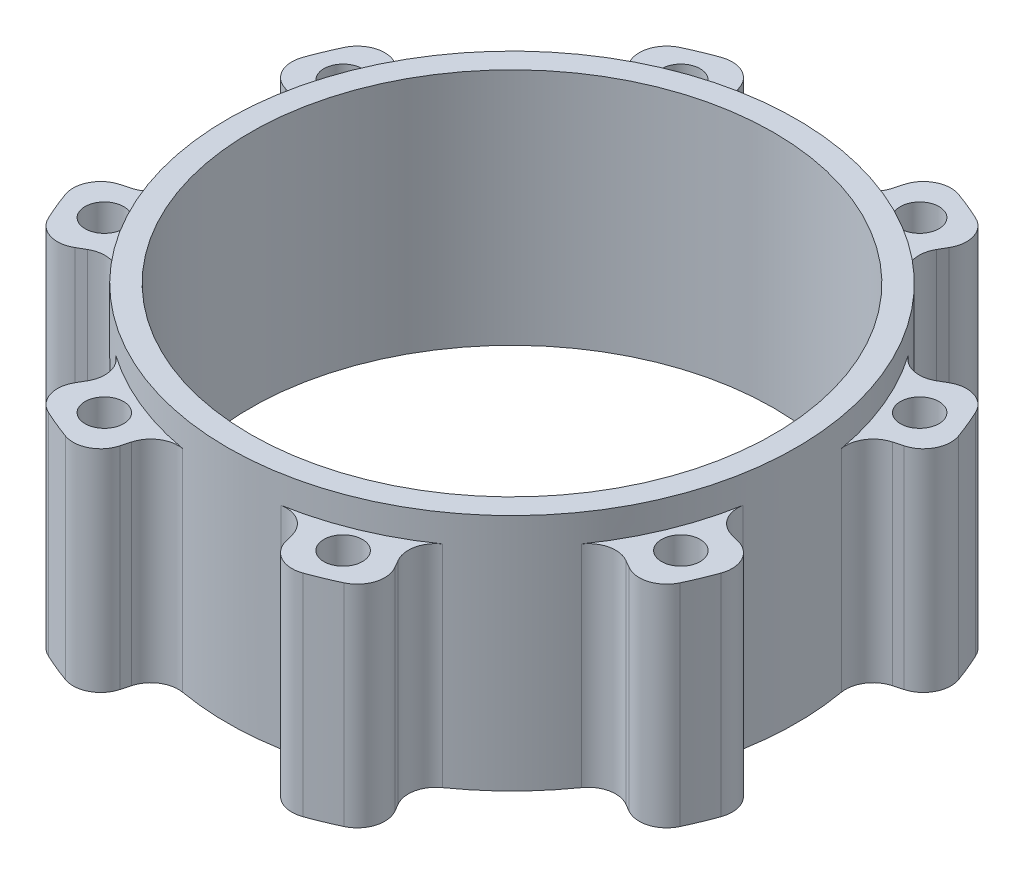
from build123d import *
from build123d.topology import SkipClean

# Parameters (mm, degrees)
SKETCH_1_R          = 38
SKETCH_1_R_2        = 28.5
EXTRUDE_1_DEPTH     = 12
SKETCH_2_R          = 2.1
CUT_EXTRUDE_1_DEPTH = 56.063599592
SKETCH_4_R          = 31
SKETCH_4_R_2        = 28.5
EXTRUDE_2_DEPTH     = 3
CUT_EXTRUDE_2_DEPTH = 56.794264938
FILLET_1_R          = 3
EXTRUDE_3_DEPTH     = 11
SKETCH_7_R          = 28.5
EXTRUDE_4_DEPTH     = 11
SKETCH_8_R          = 2.1
CUT_EXTRUDE_3_DEPTH = 58.048728436


with BuildPart() as part:
    # 草图1 → 凸台-拉伸1 (new body)
    with BuildSketch(Plane(origin=(0, 0, 0), x_dir=(1, 0, 0), z_dir=(0, 1, 0))):
        with Locations(Location((0, 0, 0), (0, 0, 270))):
            Circle(SKETCH_1_R)
        with Locations(Location((0, 0, 0), (0, 0, 270))):
            Circle(SKETCH_1_R_2, mode=Mode.SUBTRACT)
    extrude(amount=EXTRUDE_1_DEPTH)

    # 草图2 → 切除-拉伸1 (cut, through all)
    with BuildSketch(Plane(origin=(0, 12, 0), x_dir=(1, 0, 0), z_dir=(0, 1, 0))):
        with Locations(Location((13.0112367, 31.411904105, 0), (0, 0, 270))):
            Circle(SKETCH_2_R)
        with Locations(Location((31.411904105, 13.0112367, 0), (0, 0, 270))):
            Circle(SKETCH_2_R)
        with Locations(Location((31.411904105, -13.0112367, 0), (0, 0, 270))):
            Circle(SKETCH_2_R)
        with Locations(Location((13.0112367, -31.411904105, 0), (0, 0, 270))):
            Circle(SKETCH_2_R)
        with Locations(Location((-13.0112367, -31.411904105, 0), (0, 0, 270))):
            Circle(SKETCH_2_R)
        with Locations(Location((-31.411904105, -13.0112367, 0), (0, 0, 270))):
            Circle(SKETCH_2_R)
        with Locations(Location((-31.411904105, 13.0112367, 0), (0, 0, 270))):
            Circle(SKETCH_2_R)
        with Locations(Location((-13.0112367, 31.411904105, 0), (0, 0, 270))):
            Circle(SKETCH_2_R)
    extrude(amount=-CUT_EXTRUDE_1_DEPTH, mode=Mode.SUBTRACT)

    # 草图4 → 凸台-拉伸2 (add)
    with BuildSketch(Plane(origin=(0, 12, 0), x_dir=(1, 0, 0), z_dir=(0, 1, 0))):
        with Locations(Location((0, 0, 0), (0, 0, 270))):
            Circle(SKETCH_4_R)
        with Locations(Location((0, 0, 0), (0, 0, 270))):
            Circle(SKETCH_4_R_2, mode=Mode.SUBTRACT)
    extrude(amount=EXTRUDE_2_DEPTH)

    # 草图5 → 切除-拉伸2 (cut, through all)
    with BuildSketch(Plane.XZ):
        with BuildLine():
            ThreePointArc((31, 0), (30.734790703, -4.046311959), (29.943700615, -8.023390398))
            Line((29.943700615, -8.023390398), (36.705181399, -9.835123714))
            ThreePointArc((36.705181399, -9.835123714), (37.674904732, -4.959995304), (38, 0))
            ThreePointArc((38, 0), (37.674904732, 4.959995304), (36.705181399, 9.835123714))
            Line((36.705181399, 9.835123714), (29.943700615, 8.023390398))
            ThreePointArc((29.943700615, 8.023390398), (30.734790703, 4.046311959), (31, 0))
        make_face()
        with BuildLine():
            ThreePointArc((15.5, 26.846787517), (21.920310217, 21.920310217), (26.846787517, 15.5))
            Line((26.846787517, 15.5), (32.908965344, 19))
            ThreePointArc((32.908965344, 19), (26.870057685, 26.870057685), (19, 32.908965344))
            Line((19, 32.908965344), (15.5, 26.846787517))
        make_face()
        with BuildLine():
            ThreePointArc((0, 38), (-4.959995304, 37.674904732), (-9.835123714, 36.705181399))
            Line((-9.835123714, 36.705181399), (-8.023390398, 29.943700615))
            ThreePointArc((-8.023390398, 29.943700615), (-4.046311959, 30.734790703), (0, 31))
            Line((0, 31), (0, 38))
        make_face()
        with BuildLine():
            ThreePointArc((9.835123714, 36.705181399), (4.959995304, 37.674904732), (0, 38))
            Line((0, 38), (0, 31))
            ThreePointArc((0, 31), (4.046311959, 30.734790703), (8.023390398, 29.943700615))
            Line((8.023390398, 29.943700615), (9.835123714, 36.705181399))
        make_face()
        with BuildLine():
            Line((-15.5, 26.846787517), (-19, 32.908965344))
            ThreePointArc((-19, 32.908965344), (-26.870057685, 26.870057685), (-32.908965344, 19))
            Line((-32.908965344, 19), (-26.846787517, 15.5))
            ThreePointArc((-26.846787517, 15.5), (-21.920310217, 21.920310217), (-15.5, 26.846787517))
        make_face()
        with BuildLine():
            ThreePointArc((-29.943700615, -8.023390398), (-31, 0), (-29.943700615, 8.023390398))
            Line((-29.943700615, 8.023390398), (-36.705181399, 9.835123714))
            ThreePointArc((-36.705181399, 9.835123714), (-38, 0), (-36.705181399, -9.835123714))
            Line((-36.705181399, -9.835123714), (-29.943700615, -8.023390398))
        make_face()
        with BuildLine():
            ThreePointArc((-15.5, -26.846787517), (-21.920310217, -21.920310217), (-26.846787517, -15.5))
            Line((-26.846787517, -15.5), (-32.908965344, -19))
            ThreePointArc((-32.908965344, -19), (-26.870057685, -26.870057685), (-19, -32.908965344))
            Line((-19, -32.908965344), (-15.5, -26.846787517))
        make_face()
        with BuildLine():
            ThreePointArc((8.023390398, -29.943700615), (0, -31), (-8.023390398, -29.943700615))
            Line((-8.023390398, -29.943700615), (-9.835123714, -36.705181399))
            ThreePointArc((-9.835123714, -36.705181399), (0, -38), (9.835123714, -36.705181399))
            Line((9.835123714, -36.705181399), (8.023390398, -29.943700615))
        make_face()
        with BuildLine():
            ThreePointArc((26.846787517, -15.5), (21.920310217, -21.920310217), (15.5, -26.846787517))
            Line((15.5, -26.846787517), (19, -32.908965344))
            ThreePointArc((19, -32.908965344), (26.870057685, -26.870057685), (32.908965344, -19))
            Line((32.908965344, -19), (26.846787517, -15.5))
        make_face()
    extrude(amount=-CUT_EXTRUDE_2_DEPTH, mode=Mode.SUBTRACT)

    # 圆角1
    # the kernel refuses this fillet: 3 mm, written as the material it adds along each edge
    with BuildSketch(Plane(origin=(15.5, 0, -26.846787517), x_dir=(0.8431001790533391, 0, 0.5377565323454729), z_dir=(0, 1, 0)), Plane(origin=(-8.023390398, 0, -29.943700615), x_dir=(0.9764131444770549, 0, -0.21591056317936408), z_dir=(0, 1, 0)), Plane(origin=(-26.846787517, 0, -15.5), x_dir=(0.5377565323455356, 0, -0.8431001790532991), z_dir=(0, 1, 0)), Plane(origin=(-29.943700615, 0, 8.023390398), x_dir=(-0.21591056317914886, 0, -0.9764131444771023), z_dir=(0, 1, 0)), Plane(origin=(-15.5, 0, 26.846787517), x_dir=(-0.843100179053171, 0, -0.5377565323457362), z_dir=(0, 1, 0)), Plane(origin=(26.846787517, 0, 15.5), x_dir=(-0.5377565323456782, 0, 0.8431001790532081), z_dir=(0, 1, 0)), Plane(origin=(29.943700615, 0, -8.023390398), x_dir=(0.21591056317925006, 0, 0.97641314447708), z_dir=(0, 1, 0))) as fillet_1_piece_1:
        with BuildLine():
            CenterArc((2.870447355, 2.997073318), FILLET_1_R, 182.531046482, 84.937907036)
            Line((-0.126625963, 2.864591132), (0, 0))
            ThreePointArc((0, 0), (1.368982585, 0.030242386), (2.737965169, 0))
        make_face()
    extrude(amount=12)
    with BuildSketch(Plane(origin=(26.846787517, 0, -15.5), x_dir=(-0.5377565323455209, 0, -0.8431001790533084), z_dir=(0, 1, 0)), Plane(origin=(-8.023390398, 0, 29.943700615), x_dir=(0.9764131444771329, 0, 0.21591056317901047), z_dir=(0, 1, 0)), Plane(origin=(15.5, 0, 26.846787517), x_dir=(0.8431001790531747, 0, -0.5377565323457305), z_dir=(0, 1, 0)), Plane(origin=(29.943700615, 0, 8.023390398), x_dir=(0.2159105631791721, 0, -0.9764131444770973), z_dir=(0, 1, 0))) as fillet_1_piece_2:
        with BuildLine():
            CenterArc((2.870447355, -2.997073318), FILLET_1_R, 92.531046482, 84.937907036)
            Line((-0.126625963, -2.864591132), (0, 0))
            ThreePointArc((0, 0), (1.368982585, -0.030242386), (2.737965169, 0))
        make_face()
    extrude(amount=12)
    with BuildSketch(Plane(origin=(8.023390398, 0, -29.943700615), x_dir=(0.2588190451024918, 0, -0.9659258262890761), z_dir=(0, 1, 0)), Plane(origin=(-15.5, 0, -26.846787517), x_dir=(-0.5000000000001898, 0, -0.866025403784329), z_dir=(0, 1, 0)), Plane(origin=(-29.943700615, 0, -8.023390398), x_dir=(-0.9659258262890777, 0, -0.25881904510248516), z_dir=(0, 1, 0)), Plane(origin=(-26.846787517, 0, 15.5), x_dir=(-0.8660254037843256, 0, 0.5000000000001957), z_dir=(0, 1, 0))) as fillet_1_piece_3:
        with BuildLine():
            CenterArc((2.867388444, 3), FILLET_1_R, 185.062092964, 84.937907036)
            ThreePointArc((-0.120910537, 2.735294118), (-0.030242386, 1.368982585), (0, 0))
            Line((0, 0), (2.867388444, 0))
        make_face()
    extrude(amount=12)
    with BuildSketch(Plane(origin=(8.023390398, 0, 29.943700615), x_dir=(0.25881904510250275, 0, 0.9659258262890731), z_dir=(0, 1, 0))) as fillet_1_piece_4:
        with BuildLine():
            CenterArc((2.867388444, -3), FILLET_1_R, 90, 84.937907036)
            ThreePointArc((-0.120910537, -2.735294118), (-0.030242386, -1.368982585), (0, 0))
            Line((0, 0), (2.867388444, 0))
        make_face()
    extrude(amount=12)
    # the kernel refuses this fillet: 3 mm, written as the material it takes off along each edge
    with BuildSketch(Plane(origin=(32.908965344, -8.150359418, -19), x_dir=(0.4623901879594874, 0, 0.8866765555030706), z_dir=(0, 1, 0)), Plane(origin=(9.835123714, -8.150359418, -36.705181399), x_dir=(0.9539342425756279, 0, 0.30001576765507343), z_dir=(0, 1, 0)), Plane(origin=(-19, -8.150359418, -32.908965344), x_dir=(0.8866765555030693, 0, -0.46239018795949005), z_dir=(0, 1, 0)), Plane(origin=(-36.705181399, -8.150359418, -9.835123714), x_dir=(0.30001576765507165, 0, -0.9539342425756285), z_dir=(0, 1, 0)), Plane(origin=(-32.908965344, -8.150359418, 19), x_dir=(-0.4623901879594926, 0, -0.8866765555030679), z_dir=(0, 1, 0)), Plane(origin=(-9.835123714, -8.150359418, 36.705181399), x_dir=(-0.9539342425756258, 0, -0.30001576765508037), z_dir=(0, 1, 0)), Plane(origin=(19, -8.150359418, 32.908965344), x_dir=(-0.886676555503072, 0, 0.46239018795948483), z_dir=(0, 1, 0)), Plane(origin=(36.705181399, -8.150359418, 9.835123714), x_dir=(-0.30001576765507776, 0, 0.9539342425756266), z_dir=(0, 1, 0))) as fillet_1_2_piece_1:
        with BuildLine():
            CenterArc((3.131453882, -2.997238548), FILLET_1_R, 87.541449832, 94.917100336)
            Line((0.134215334, -3.125928434), (0, 0))
            ThreePointArc((0, 0), (1.630071884, 0.034978393), (3.260143767, 0))
        make_face()
    extrude(amount=28.300718837, mode=Mode.SUBTRACT)
    with BuildSketch(Plane(origin=(19, -8.150359418, -32.908965344), x_dir=(-0.49999999999999534, 0, 0.8660254037844413), z_dir=(0, 1, 0)), Plane(origin=(-9.835123714, -8.150359418, -36.705181399), x_dir=(0.2588190451025281, 0, 0.9659258262890663), z_dir=(0, 1, 0)), Plane(origin=(-32.908965344, -8.150359418, -19), x_dir=(0.8660254037844429, 0, 0.4999999999999924), z_dir=(0, 1, 0)), Plane(origin=(-36.705181399, -8.150359418, 9.835123714), x_dir=(0.9659258262890654, 0, -0.2588190451025314), z_dir=(0, 1, 0)), Plane(origin=(-19, -8.150359418, 32.908965344), x_dir=(0.49999999999998923, 0, -0.8660254037844448), z_dir=(0, 1, 0)), Plane(origin=(32.908965344, -8.150359418, 19), x_dir=(-0.8660254037844397, 0, -0.499999999999998), z_dir=(0, 1, 0)), Plane(origin=(36.705181399, -8.150359418, -9.835123714), x_dir=(-0.9659258262890671, 0, 0.25881904510252496), z_dir=(0, 1, 0))) as fillet_1_2_piece_2:
        with BuildLine():
            CenterArc((3.128808452, -3), FILLET_1_R, 90, 94.917100336)
            ThreePointArc((0.139849176, -3.257142857), (0.034978393, -1.630071884), (0, 0))
            Line((0, 0), (3.128808452, 0))
        make_face()
    extrude(amount=28.300718837, mode=Mode.SUBTRACT)
    with BuildSketch(Plane(origin=(9.835123714, -8.150359418, 36.705181399), x_dir=(0.9539342425756233, 0, -0.30001576765508847), z_dir=(0, 1, 0))) as fillet_1_2_piece_3:
        with BuildLine():
            CenterArc((3.131453882, 2.997238548), FILLET_1_R, 177.541449832, 94.917100336)
            Line((0.134215334, 3.125928434), (0, 0))
            ThreePointArc((0, 0), (1.630071884, -0.034978393), (3.260143767, 0))
        make_face()
    extrude(amount=28.300718837, mode=Mode.SUBTRACT)

    # 草图6 → 凸台-拉伸3 (add)
    with SkipClean():  # the faces are left unmerged after this step: merging them gives an invalid solid
        with BuildSketch(Plane(origin=(0, 12, 0), x_dir=(1, 0, 0), z_dir=(0, 1, 0))):
            with BuildLine():
                Line((-16.933694222, -29.330018752), (-17.435595774, -30.199337741))
                ThreePointArc((-17.435595774, -30.199337741), (-17.699322291, -32.599385044), (-16.109306954, -34.416423833))
                ThreePointArc((-16.109306954, -34.416423833), (-14.54197043, -35.107422235), (-12.945086489, -35.727086864))
                ThreePointArc((-12.945086489, -35.727086864), (-10.535935413, -35.566557041), (-9.025328498, -33.68298451))
                Line((-9.025328498, -33.68298451), (-8.765525137, -32.713385167))
                ThreePointArc((-8.765525137, -32.713385167), (-7.481017255, -30.960541765), (-5.350005218, -30.534856217))
                ThreePointArc((-5.350005218, -30.534856217), (-11.863186403, -28.640265508), (-17.808378924, -25.374428862))
                ThreePointArc((-17.808378924, -25.374428862), (-16.602531, -27.182287063), (-16.933694222, -29.330018752))
            make_face()
            with BuildLine():
                Line((-32.713385167, -8.765525137), (-33.68298451, -9.025328498))
                ThreePointArc((-33.68298451, -9.025328498), (-35.566557041, -10.535935413), (-35.727086864, -12.945086489))
                ThreePointArc((-35.727086864, -12.945086489), (-35.107422235, -14.54197043), (-34.416423833, -16.109306954))
                ThreePointArc((-34.416423833, -16.109306954), (-32.599385044, -17.699322291), (-30.199337741, -17.435595774))
                Line((-30.199337741, -17.435595774), (-29.330018752, -16.933694222))
                ThreePointArc((-29.330018752, -16.933694222), (-27.182287063, -16.602531), (-25.374428862, -17.808378924))
                ThreePointArc((-25.374428862, -17.808378924), (-28.640265508, -11.863186403), (-30.534856217, -5.350005218))
                ThreePointArc((-30.534856217, -5.350005218), (-30.960541765, -7.481017255), (-32.713385167, -8.765525137))
            make_face()
            with BuildLine():
                Line((-29.330018752, 16.933694222), (-30.199337741, 17.435595774))
                ThreePointArc((-30.199337741, 17.435595774), (-32.599385044, 17.699322291), (-34.416423833, 16.109306954))
                ThreePointArc((-34.416423833, 16.109306954), (-35.107422235, 14.54197043), (-35.727086864, 12.945086489))
                ThreePointArc((-35.727086864, 12.945086489), (-35.566557041, 10.535935413), (-33.68298451, 9.025328498))
                Line((-33.68298451, 9.025328498), (-32.713385167, 8.765525137))
                ThreePointArc((-32.713385167, 8.765525137), (-30.960541765, 7.481017255), (-30.534856217, 5.350005218))
                ThreePointArc((-30.534856217, 5.350005218), (-28.640265508, 11.863186403), (-25.374428862, 17.808378924))
                ThreePointArc((-25.374428862, 17.808378924), (-27.182287063, 16.602531), (-29.330018752, 16.933694222))
            make_face()
            with BuildLine():
                Line((-8.765525137, 32.713385167), (-9.025328498, 33.68298451))
                ThreePointArc((-9.025328498, 33.68298451), (-10.535935413, 35.566557041), (-12.945086489, 35.727086864))
                ThreePointArc((-12.945086489, 35.727086864), (-14.54197043, 35.107422235), (-16.109306954, 34.416423833))
                ThreePointArc((-16.109306954, 34.416423833), (-17.699322291, 32.599385044), (-17.435595774, 30.199337741))
                Line((-17.435595774, 30.199337741), (-16.933694222, 29.330018752))
                ThreePointArc((-16.933694222, 29.330018752), (-16.602531, 27.182287063), (-17.808378924, 25.374428862))
                ThreePointArc((-17.808378924, 25.374428862), (-11.863186403, 28.640265508), (-5.350005218, 30.534856217))
                ThreePointArc((-5.350005218, 30.534856217), (-7.481017255, 30.960541765), (-8.765525137, 32.713385167))
            make_face()
            with BuildLine():
                Line((16.933694222, 29.330018752), (17.435595774, 30.199337741))
                ThreePointArc((17.435595774, 30.199337741), (17.699322291, 32.599385044), (16.109306954, 34.416423833))
                ThreePointArc((16.109306954, 34.416423833), (14.54197043, 35.107422235), (12.945086489, 35.727086864))
                ThreePointArc((12.945086489, 35.727086864), (10.535935413, 35.566557041), (9.025328498, 33.68298451))
                Line((9.025328498, 33.68298451), (8.765525137, 32.713385167))
                ThreePointArc((8.765525137, 32.713385167), (7.481017255, 30.960541765), (5.350005218, 30.534856217))
                ThreePointArc((5.350005218, 30.534856217), (11.863186403, 28.640265508), (17.808378924, 25.374428862))
                ThreePointArc((17.808378924, 25.374428862), (16.602531, 27.182287063), (16.933694222, 29.330018752))
            make_face()
            with BuildLine():
                Line((32.713385167, 8.765525137), (33.68298451, 9.025328498))
                ThreePointArc((33.68298451, 9.025328498), (35.566557041, 10.535935413), (35.727086864, 12.945086489))
                ThreePointArc((35.727086864, 12.945086489), (35.107422235, 14.54197043), (34.416423833, 16.109306954))
                ThreePointArc((34.416423833, 16.109306954), (32.599385044, 17.699322291), (30.199337741, 17.435595774))
                Line((30.199337741, 17.435595774), (29.330018752, 16.933694222))
                ThreePointArc((29.330018752, 16.933694222), (27.182287063, 16.602531), (25.374428862, 17.808378924))
                ThreePointArc((25.374428862, 17.808378924), (28.640265508, 11.863186403), (30.534856217, 5.350005218))
                ThreePointArc((30.534856217, 5.350005218), (30.960541765, 7.481017255), (32.713385167, 8.765525137))
            make_face()
            with BuildLine():
                Line((8.765525137, -32.713385167), (9.025328498, -33.68298451))
                ThreePointArc((9.025328498, -33.68298451), (10.535935413, -35.566557041), (12.945086489, -35.727086864))
                ThreePointArc((12.945086489, -35.727086864), (14.54197043, -35.107422235), (16.109306954, -34.416423833))
                ThreePointArc((16.109306954, -34.416423833), (17.699322291, -32.599385044), (17.435595774, -30.199337741))
                Line((17.435595774, -30.199337741), (16.933694222, -29.330018752))
                ThreePointArc((16.933694222, -29.330018752), (16.602531, -27.182287063), (17.808378924, -25.374428862))
                ThreePointArc((17.808378924, -25.374428862), (11.863186403, -28.640265508), (5.350005218, -30.534856217))
                ThreePointArc((5.350005218, -30.534856217), (7.481017255, -30.960541765), (8.765525137, -32.713385167))
            make_face()
            with BuildLine():
                Line((29.330018752, -16.933694222), (30.199337741, -17.435595774))
                ThreePointArc((30.199337741, -17.435595774), (32.599385044, -17.699322291), (34.416423833, -16.109306954))
                ThreePointArc((34.416423833, -16.109306954), (35.107422235, -14.54197043), (35.727086864, -12.945086489))
                ThreePointArc((35.727086864, -12.945086489), (35.566557041, -10.535935413), (33.68298451, -9.025328498))
                Line((33.68298451, -9.025328498), (32.713385167, -8.765525137))
                ThreePointArc((32.713385167, -8.765525137), (30.960541765, -7.481017255), (30.534856217, -5.350005218))
                ThreePointArc((30.534856217, -5.350005218), (28.640265508, -11.863186403), (25.374428862, -17.808378924))
                ThreePointArc((25.374428862, -17.808378924), (27.182287063, -16.602531), (29.330018752, -16.933694222))
            make_face()
        extrude(amount=EXTRUDE_3_DEPTH)

    # 草图7 → 凸台-拉伸4 (add)
    with SkipClean():  # the faces are left unmerged after this step: merging them gives an invalid solid
        with BuildSketch(Plane(origin=(0, 15, 0), x_dir=(1, 0, 0), z_dir=(0, 1, 0))):
            with BuildLine():
                ThreePointArc((5.350005218, -30.534856217), (11.863186403, -28.640265508), (17.808378924, -25.374428862))
                ThreePointArc((17.808378924, -25.374428862), (21.920310217, -21.920310217), (25.374428862, -17.808378924))
                ThreePointArc((25.374428862, -17.808378924), (28.640265508, -11.863186403), (30.534856217, -5.350005218))
                ThreePointArc((30.534856217, -5.350005218), (31, 0), (30.534856217, 5.350005218))
                ThreePointArc((30.534856217, 5.350005218), (28.640265508, 11.863186403), (25.374428862, 17.808378924))
                ThreePointArc((25.374428862, 17.808378924), (21.920310217, 21.920310217), (17.808378924, 25.374428862))
                ThreePointArc((17.808378924, 25.374428862), (11.863186403, 28.640265508), (5.350005218, 30.534856217))
                ThreePointArc((5.350005218, 30.534856217), (0, 31), (-5.350005218, 30.534856217))
                ThreePointArc((-5.350005218, 30.534856217), (-11.863186403, 28.640265508), (-17.808378924, 25.374428862))
                ThreePointArc((-17.808378924, 25.374428862), (-21.920310217, 21.920310217), (-25.374428862, 17.808378924))
                ThreePointArc((-25.374428862, 17.808378924), (-28.640265508, 11.863186403), (-30.534856217, 5.350005218))
                ThreePointArc((-30.534856217, 5.350005218), (-31, 0), (-30.534856217, -5.350005218))
                ThreePointArc((-30.534856217, -5.350005218), (-28.640265508, -11.863186403), (-25.374428862, -17.808378924))
                ThreePointArc((-25.374428862, -17.808378924), (-21.920310217, -21.920310217), (-17.808378924, -25.374428862))
                ThreePointArc((-17.808378924, -25.374428862), (-11.863186403, -28.640265508), (-5.350005218, -30.534856217))
                ThreePointArc((-5.350005218, -30.534856217), (0, -31), (5.350005218, -30.534856217))
            make_face()
            with Locations(Location((0, 0, 0), (0, 0, 270))):
                Circle(SKETCH_7_R, mode=Mode.SUBTRACT)
        extrude(amount=EXTRUDE_4_DEPTH)

    # 草图8 → 切除-拉伸3 (cut, through all)
    with SkipClean():  # the faces are left unmerged after this step: merging them gives an invalid solid
        with BuildSketch(Plane.XZ):
            with Locations(Location((-13.0112367, -31.411904105, 0), (0, 0, 90))):
                Circle(SKETCH_8_R)
            with Locations(Location((13.0112367, -31.411904105, 0), (0, 0, 90))):
                Circle(SKETCH_8_R)
            with Locations(Location((31.411904105, -13.0112367, 0), (0, 0, 90))):
                Circle(SKETCH_8_R)
            with Locations(Location((-31.411904105, -13.0112367, 0), (0, 0, 90))):
                Circle(SKETCH_8_R)
            with Locations(Location((-31.411904105, 13.0112367, 0), (0, 0, 90))):
                Circle(SKETCH_8_R)
            with Locations(Location((-13.0112367, 31.411904105, 0), (0, 0, 90))):
                Circle(SKETCH_8_R)
            with Locations(Location((13.0112367, 31.411904105, 0), (0, 0, 90))):
                Circle(SKETCH_8_R)
            with Locations(Location((31.411904105, 13.0112367, 0), (0, 0, 90))):
                Circle(SKETCH_8_R)
        extrude(amount=-CUT_EXTRUDE_3_DEPTH, mode=Mode.SUBTRACT)


solid = part.part
